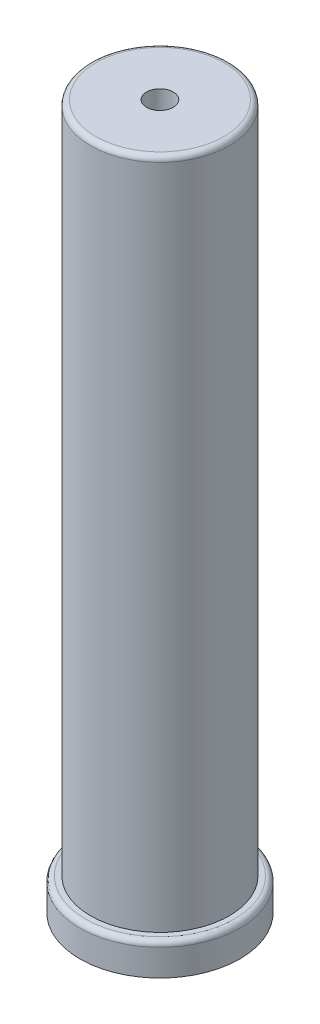
from build123d import *

# Parameters (mm, degrees)
SKETCH_1_R          = 7.5
SKETCH_1_R_2        = 1.25
EXTRUDE_1_DEPTH     = 3
SKETCH_2_R          = 6.5
EXTRUDE_2_DEPTH     = 63
SKETCH_3_R          = 1.25
CUT_EXTRUDE_1_DEPTH = 64.886618317
FILLET_1_R          = 0.5


with BuildPart() as part:
    # Эскиз1 → Бобышка-Вытянуть1 (new body)
    with BuildSketch(Plane(origin=(0, 0, 0), x_dir=(1, 0, 0), z_dir=(0, 1, 0))):
        Circle(SKETCH_1_R)
        Circle(SKETCH_1_R_2, mode=Mode.SUBTRACT)
    extrude(amount=EXTRUDE_1_DEPTH)

    # Эскиз2 → Бобышка-Вытянуть2 (add)
    with BuildSketch(Plane(origin=(0, 3, 0), x_dir=(1, 0, 0), z_dir=(0, 1, 0))):
        Circle(SKETCH_2_R)
    extrude(amount=EXTRUDE_2_DEPTH)

    # Эскиз3 → Вырез-Вытянуть1 (cut, through all)
    with BuildSketch(Plane.XZ.offset(-3)):
        Circle(SKETCH_3_R)
    extrude(amount=-CUT_EXTRUDE_1_DEPTH, mode=Mode.SUBTRACT)

    # Скругление1
    fillet_1_edges = [part.edges().sort_by_distance(p)[0] for p in [
        (-6.5, 66, 0),
        (-7.5, 3, 0),
    ]]
    fillet(fillet_1_edges, radius=FILLET_1_R)


solid = part.part
